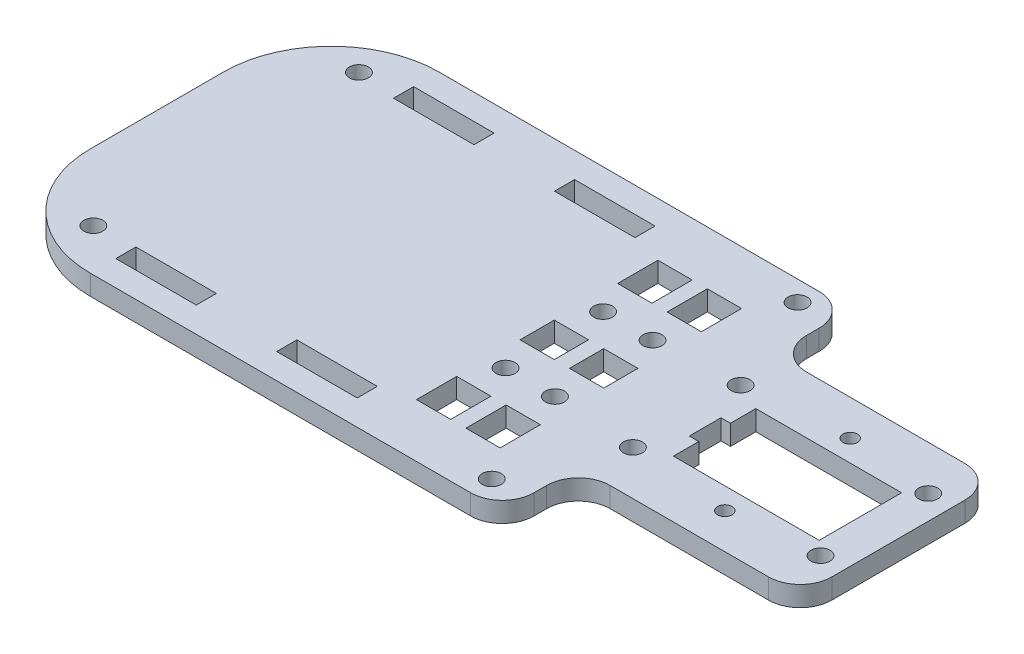
from build123d import *

# Parameters (mm, degrees)
SKETCH1_R           = 1.5
SKETCH1_R_2         = 1.15
SKETCH1_R_3         = 1.4999
SKETCH1_R_4         = 1.499900003
SKETCH1_W           = 5.4
SKETCH1_H           = 6.35
SKETCH1_H_2         = 5.4
SKETCH1_W_2         = 12.7
SKETCH1_H_3         = 3.175
BOSS_EXTRUDE1_DEPTH = 3.175


with BuildPart() as part:
    # Sketch1 → Boss-Extrude1 (new body)
    with BuildSketch(Plane(origin=(0, 0, 0), x_dir=(1, 0, 0), z_dir=(0, 1, 0))):
        with BuildLine():
            Line((17, 0), (77, 0))
            ThreePointArc((77, 0), (80.535533906, 1.464466094), (82, 5))
            Line((82, 5), (82, 7))
            ThreePointArc((82, 7), (83.464466094, 10.535533906), (87, 12))
            Line((87, 12), (112, 12))
            ThreePointArc((112, 12), (115.535533906, 13.464466094), (117, 17))
            Line((117, 17), (117, 38))
            ThreePointArc((117, 38), (115.535533906, 41.535533906), (112, 43))
            Line((112, 43), (87, 43))
            ThreePointArc((87, 43), (83.464466094, 44.464466094), (82, 48))
            Line((82, 48), (82, 50))
            ThreePointArc((82, 50), (80.535533906, 53.535533906), (77, 55))
            Line((77, 55), (17, 55))
            ThreePointArc((17, 55), (4.97918472, 50.02081528), (0, 38))
            Line((0, 38), (0, 17))
            ThreePointArc((0, 17), (4.97918472, 4.97918472), (17, 0))
        make_face()
        with Locations((62.7, 35.2)):
            Circle(SKETCH1_R, mode=Mode.SUBTRACT)
        with Locations((70.5, 35.2)):
            Circle(SKETCH1_R, mode=Mode.SUBTRACT)
        with Locations((62.7, 19.8)):
            Circle(SKETCH1_R, mode=Mode.SUBTRACT)
        with Locations((70.5, 19.8)):
            Circle(SKETCH1_R, mode=Mode.SUBTRACT)
        with Locations((10.73981072, 48.62727462)):
            Circle(SKETCH1_R, mode=Mode.SUBTRACT)
        with Locations((10.73981072, 6.71727462)):
            Circle(SKETCH1_R, mode=Mode.SUBTRACT)
        with Locations((76.77981072, 3.54227462)):
            Circle(SKETCH1_R, mode=Mode.SUBTRACT)
        with Locations((76.77981072, 51.80227462)):
            Circle(SKETCH1_R, mode=Mode.SUBTRACT)
        with Locations((83.6, 36)):
            Circle(SKETCH1_R, mode=Mode.SUBTRACT)
        with Locations((99.5, 37.4)):
            Circle(SKETCH1_R_2, mode=Mode.SUBTRACT)
        with Locations((99.5, 17.6)):
            Circle(SKETCH1_R_2, mode=Mode.SUBTRACT)
        with Locations((83.6, 19)):
            Circle(SKETCH1_R_3, mode=Mode.SUBTRACT)
        with Locations((113.2, 19)):
            Circle(SKETCH1_R_4, mode=Mode.SUBTRACT)
        with Locations((113.2, 36)):
            Circle(SKETCH1_R_4, mode=Mode.SUBTRACT)
        with Locations((62.7, 43.375)):
            Rectangle(SKETCH1_W, SKETCH1_H, mode=Mode.SUBTRACT)
        with Locations((62.7, 11.625)):
            Rectangle(SKETCH1_W, SKETCH1_H, mode=Mode.SUBTRACT)
        with Locations((62.7, 27.5)):
            Rectangle(SKETCH1_W, SKETCH1_H_2, mode=Mode.SUBTRACT)
        with Locations((70.5, 43.375)):
            Rectangle(SKETCH1_W, SKETCH1_H, mode=Mode.SUBTRACT)
        with Locations((70.5, 27.5)):
            Rectangle(SKETCH1_W, SKETCH1_H_2, mode=Mode.SUBTRACT)
        with Locations((70.5, 11.625)):
            Rectangle(SKETCH1_W, SKETCH1_H, mode=Mode.SUBTRACT)
        with Locations((48.75, 5.5875)):
            Rectangle(SKETCH1_W_2, SKETCH1_H_3, mode=Mode.SUBTRACT)
        with Locations((23.35, 49.4125)):
            Rectangle(SKETCH1_W_2, SKETCH1_H_3, mode=Mode.SUBTRACT)
        with Locations((48.75, 49.4125)):
            Rectangle(SKETCH1_W_2, SKETCH1_H_3, mode=Mode.SUBTRACT)
        with Locations((23.35, 5.5875)):
            Rectangle(SKETCH1_W_2, SKETCH1_H_3, mode=Mode.SUBTRACT)
        Polygon((88, 34), (111, 34), (111, 21), (88, 21), (88, 25), (86.5, 25), (86.5, 30), (88, 30), align=None, mode=Mode.SUBTRACT)
    extrude(amount=BOSS_EXTRUDE1_DEPTH)


solid = part.part
